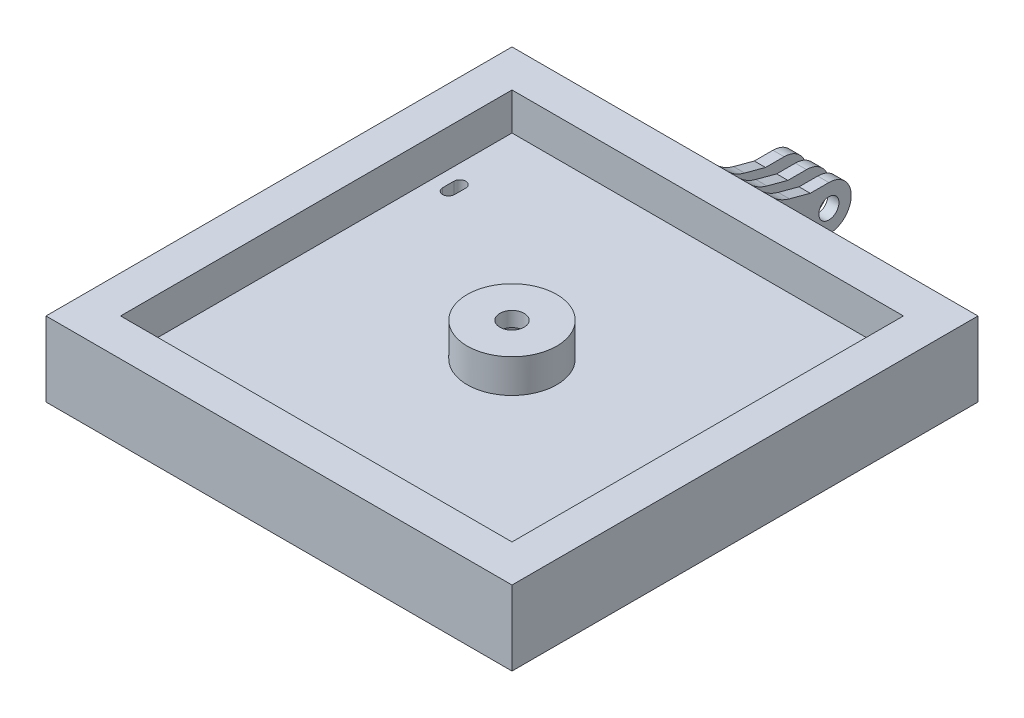
from build123d import *
from OCP.BRepFilletAPI import BRepFilletAPI_MakeChamfer

# Parameters (mm, degrees)
SKETCH1_W           = 125
SKETCH1_H           = 125
SKETCH1_W_2         = 105
SKETCH1_H_2         = 105
BOSS_EXTRUDE1_DEPTH = 10
SKETCH2_W           = 125
SKETCH2_H           = 125
BOSS_EXTRUDE2_DEPTH = 10
CUT_EXTRUDE1_DEPTH  = 10
CUT_EXTRUDE2_DEPTH  = 5
BOSS_EXTRUDE4_DEPTH = 1.5
LPATTERN3_COUNT     = 2
LPATTERN3_PITCH     = 6
LPATTERN3_COL_COUNT = 2
LPATTERN3_COL_PITCH = 6
CHAMFER1_SIZE       = 10
CHAMFER1_SIZE2      = 2.679491924
FILLET1_R           = 10
SKETCH6_R           = 2.7
CUT_EXTRUDE3_DEPTH  = 110.417777349
CUT_EXTRUDE4_DEPTH  = 10
SKETCH8_R           = 12
BOSS_EXTRUDE5_DEPTH = 5
SKETCH9_R           = 12
SKETCH9_R_2         = 3.25
BOSS_EXTRUDE6_DEPTH = 4


with BuildPart() as part:
    # Sketch1 → Boss-Extrude1 (new body)
    with BuildSketch(Plane(origin=(0, 0, 0), x_dir=(1, 0, 0), z_dir=(0, 1, 0))):
        Rectangle(SKETCH1_W, SKETCH1_H)
        Rectangle(SKETCH1_W_2, SKETCH1_H_2, mode=Mode.SUBTRACT)
    extrude(amount=BOSS_EXTRUDE1_DEPTH)

    # Sketch2 → Boss-Extrude2 (add)
    with BuildSketch(Plane.XZ):
        Rectangle(SKETCH2_W, SKETCH2_H)
    extrude(amount=BOSS_EXTRUDE2_DEPTH)

    # Sketch3 → Cut-Extrude1 (cut)
    with BuildSketch(Plane(origin=(0, 0, 0), x_dir=(1, 0, 0), z_dir=(0, 1, 0))):
        with BuildLine():
            Line((-45.9, 33.5), (-45.9, 30.5))
            ThreePointArc((-45.9, 30.5), (-47.5, 28.9), (-49.1, 30.5))
            Line((-49.1, 30.5), (-49.1, 33.5))
            ThreePointArc((-49.1, 33.5), (-47.5, 35.1), (-45.9, 33.5))
        make_face()
        with BuildLine():
            Line((-45.9, -46.5), (-45.9, -49.5))
            ThreePointArc((-45.9, -49.5), (-47.5, -51.1), (-49.1, -49.5))
            Line((-49.1, -49.5), (-49.1, -46.5))
            ThreePointArc((-49.1, -46.5), (-47.5, -44.9), (-45.9, -46.5))
        make_face()
    cut_extrude1 = extrude(amount=-CUT_EXTRUDE1_DEPTH, mode=Mode.SUBTRACT)

    # Sketch4 → Cut-Extrude2 (cut)
    with BuildSketch(Plane.XZ.offset(10)):
        with BuildLine():
            Line((-43.5, 49.5), (-43.5, 46.5))
            ThreePointArc((-43.5, 46.5), (-47.5, 42.5), (-51.5, 46.5))
            Line((-51.5, 46.5), (-51.5, 49.5))
            ThreePointArc((-51.5, 49.5), (-47.5, 53.5), (-43.5, 49.5))
        make_face()
        with BuildLine():
            Line((-43.5, -30.5), (-43.5, -33.5))
            ThreePointArc((-43.5, -33.5), (-47.5, -37.5), (-51.5, -33.5))
            Line((-51.5, -33.5), (-51.5, -30.5))
            ThreePointArc((-51.5, -30.5), (-47.5, -26.5), (-43.5, -30.5))
        make_face()
    cut_extrude2 = extrude(amount=-CUT_EXTRUDE2_DEPTH, mode=Mode.SUBTRACT)

    # Mirror1: Cut-Extrude1, Cut-Extrude2 across plane
    add(cut_extrude1.mirror(Plane(origin=(0, 0, 0), x_dir=(0, 0, 1), z_dir=(1, 0, 0))), mode=Mode.SUBTRACT)
    add(cut_extrude2.mirror(Plane(origin=(0, 0, 0), x_dir=(0, 0, 1), z_dir=(1, 0, 0))), mode=Mode.SUBTRACT)

    # Sketch5 → Boss-Extrude4 (add, symmetric)
    with BuildSketch(Plane(origin=(0, 0, 0), x_dir=(0, 0, -1), z_dir=(1, 0, 0))):
        with BuildLine():
            Line((62.5, 6), (77.5, 6))
            ThreePointArc((77.5, 6), (83.5, 0), (77.5, -6))
            Line((77.5, -6), (62.5, -6))
            Line((62.5, -6), (62.5, 6))
        make_face()
    boss_extrude4 = extrude(amount=BOSS_EXTRUDE4_DEPTH, both=True)

    # LPattern3: Boss-Extrude4 ×2
    with Locations(*[(i * LPATTERN3_PITCH, 0, 0) for i in range(1, LPATTERN3_COUNT)]):
        add(boss_extrude4)

    # LPattern3 col: Boss-Extrude4 ×2
    with Locations(*[(-i * LPATTERN3_COL_PITCH, 0, 0) for i in range(1, LPATTERN3_COL_COUNT)]):
        add(boss_extrude4)

    # Chamfer1: one chamfer whose edges measure the first distance from different faces: ONE call of the kernel's chamfer builder (chamfer() names one face for all edges)
    chamfer1_edges_1 = [part.edges().sort_by_distance(p)[0] for p in [
        (0, 6, -62.5),
    ]]
    chamfer1_side_1 = [part.faces().sort_by_distance(p)[0] for p in [
        (0, 6, -70),
    ]]
    chamfer1_edges_2 = [part.edges().sort_by_distance(p)[0] for p in [
        (0, -6, -62.5),
    ]]
    chamfer1_side_2 = [part.faces().sort_by_distance(p)[0] for p in [
        (0, -6, -70),
    ]]
    chamfer1_edges_3 = [part.edges().sort_by_distance(p)[0] for p in [
        (-6, 6, -62.5),
    ]]
    chamfer1_side_3 = [part.faces().sort_by_distance(p)[0] for p in [
        (-6, 6, -70),
    ]]
    chamfer1_edges_4 = [part.edges().sort_by_distance(p)[0] for p in [
        (-6, -6, -62.5),
    ]]
    chamfer1_side_4 = [part.faces().sort_by_distance(p)[0] for p in [
        (-6, -6, -70),
    ]]
    chamfer1_edges_5 = [part.edges().sort_by_distance(p)[0] for p in [
        (6, 6, -62.5),
    ]]
    chamfer1_side_5 = [part.faces().sort_by_distance(p)[0] for p in [
        (6, 6, -70),
    ]]
    chamfer1_edges_6 = [part.edges().sort_by_distance(p)[0] for p in [
        (6, -6, -62.5),
    ]]
    chamfer1_side_6 = [part.faces().sort_by_distance(p)[0] for p in [
        (6, -6, -70),
    ]]
    chamfer1 = BRepFilletAPI_MakeChamfer(part.part.solid().wrapped)
    for e in chamfer1_edges_1:
        chamfer1.Add(CHAMFER1_SIZE, CHAMFER1_SIZE2, e.wrapped, chamfer1_side_1[0].wrapped)  # the first distance lies on this face
    for e in chamfer1_edges_2:
        chamfer1.Add(CHAMFER1_SIZE, CHAMFER1_SIZE2, e.wrapped, chamfer1_side_2[0].wrapped)  # the first distance lies on this face
    for e in chamfer1_edges_3:
        chamfer1.Add(CHAMFER1_SIZE, CHAMFER1_SIZE2, e.wrapped, chamfer1_side_3[0].wrapped)  # the first distance lies on this face
    for e in chamfer1_edges_4:
        chamfer1.Add(CHAMFER1_SIZE, CHAMFER1_SIZE2, e.wrapped, chamfer1_side_4[0].wrapped)  # the first distance lies on this face
    for e in chamfer1_edges_5:
        chamfer1.Add(CHAMFER1_SIZE, CHAMFER1_SIZE2, e.wrapped, chamfer1_side_5[0].wrapped)  # the first distance lies on this face
    for e in chamfer1_edges_6:
        chamfer1.Add(CHAMFER1_SIZE, CHAMFER1_SIZE2, e.wrapped, chamfer1_side_6[0].wrapped)  # the first distance lies on this face
    add(Compound.cast(chamfer1.Shape()), mode=Mode.REPLACE)

    # Fillet1
    # the kernel refuses this fillet: 10 mm, written as the material it adds along each edge
    with BuildSketch(Plane(origin=(-12.86321037, 8.679491924, -62.5), x_dir=(0, 1.0, -1.888670768796517e-12), z_dir=(1, 0, 0))) as fillet1_piece_1_section:
        with BuildLine():
            CenterArc((8.48285216, -6.978597797), FILLET1_R, 135.744454957, 29.255545043)
            Line((-1.176406103, -4.390407346), (-1.369591268, -4.338643537))
            Line((-1.369591268, -4.338643537), (-0.193185165, 0.051763809))
            Line((-0.193185165, 0.051763809), (0, 0.2))
            ThreePointArc((0, 0.2), (0.660254038, 0.2), (1.177261194, 0.139571956))
            Line((1.177261194, 0.139571956), (1.320508076, 0))
        make_face()
    fillet1_piece_1 = extrude(amount=14.36321037, mode=Mode.PRIVATE)
    fillet1_piece_1 = split(fillet1_piece_1, bisect_by=Plane(origin=(-7.5, 8.578111025, -63.798963953), z_dir=(1, 0, 0)), keep=Keep.TOP, mode=Mode.PRIVATE)
    fillet1_piece_1 = split(fillet1_piece_1, bisect_by=Plane(origin=(-4.5, 8.578111025, -63.798963953), z_dir=(-1, 0, 0)), keep=Keep.TOP, mode=Mode.PRIVATE)
    add(fillet1_piece_1)
    with BuildSketch(Plane(origin=(-1.5, 8.679491924, -62.5), x_dir=(0, 1.0, -1.888670768796517e-12), z_dir=(1, 0, 0)), Plane(origin=(-7.5, 8.679491924, -62.5), x_dir=(0, 1.0, -1.888670768796517e-12), z_dir=(1, 0, 0)), Plane(origin=(4.5, 8.679491924, -62.5), x_dir=(0, 1.0, -1.888670768796517e-12), z_dir=(1, 0, 0))) as fillet1_piece_2:
        with BuildLine():
            CenterArc((8.48285216, -6.978597797), FILLET1_R, 135.744454957, 29.255545043)
            Line((-1.176406103, -4.390407346), (-1.369591268, -4.338643537))
            Line((-1.369591268, -4.338643537), (-0.193185165, 0.051763809))
            Line((-0.193185165, 0.051763809), (0, 0.2))
            ThreePointArc((0, 0.2), (0.660254038, 0.2), (1.177261194, 0.139571956))
            Line((1.177261194, 0.139571956), (1.320508076, 0))
        make_face()
    extrude(amount=3)
    with BuildSketch(Plane(origin=(-1.5, 8.679491924, -62.5), x_dir=(0, 1.0, -1.888670768796517e-12), z_dir=(1, 0, 0))) as fillet1_piece_3_section:
        with BuildLine():
            CenterArc((8.48285216, -6.978597797), FILLET1_R, 135.744454957, 29.255545043)
            Line((-1.176406103, -4.390407346), (-1.369591268, -4.338643537))
            Line((-1.369591268, -4.338643537), (-0.193185165, 0.051763809))
            Line((-0.193185165, 0.051763809), (0, 0.2))
            ThreePointArc((0, 0.2), (0.660254038, 0.2), (1.177261194, 0.139571956))
            Line((1.177261194, 0.139571956), (1.320508076, 0))
        make_face()
    fillet1_piece_3 = extrude(amount=14.36321037, mode=Mode.PRIVATE)
    fillet1_piece_3 = split(fillet1_piece_3, bisect_by=Plane(origin=(4.5, 8.578111025, -63.798963953), z_dir=(1, 0, 0)), keep=Keep.TOP, mode=Mode.PRIVATE)
    fillet1_piece_3 = split(fillet1_piece_3, bisect_by=Plane(origin=(7.5, 8.578111025, -63.798963953), z_dir=(-1, 0, 0)), keep=Keep.TOP, mode=Mode.PRIVATE)
    add(fillet1_piece_3)
    with BuildSketch(Plane(origin=(-12.86321037, -8.679491924, -62.5), x_dir=(0, -1.0, -1.7756733723730064e-12), z_dir=(1, 0, 0))) as fillet1_piece_4_section:
        with BuildLine():
            CenterArc((8.48285216, 6.978597797), FILLET1_R, 195, 29.255545043)
            Line((-1.176406103, 4.390407346), (-1.369591268, 4.338643537))
            Line((-1.369591268, 4.338643537), (-0.193185165, -0.051763809))
            Line((-0.193185165, -0.051763809), (0, -0.2))
            ThreePointArc((0, -0.2), (0.660254038, -0.2), (1.177261194, -0.139571956))
            Line((1.177261194, -0.139571956), (1.320508076, 0))
        make_face()
    fillet1_piece_4 = extrude(amount=14.36321037, mode=Mode.PRIVATE)
    fillet1_piece_4 = split(fillet1_piece_4, bisect_by=Plane(origin=(-4.5, -8.578111025, -63.798963953), z_dir=(-1, 0, 0)), keep=Keep.TOP, mode=Mode.PRIVATE)
    fillet1_piece_4 = split(fillet1_piece_4, bisect_by=Plane(origin=(-7.5, -8.578111025, -63.798963953), z_dir=(1, 0, 0)), keep=Keep.TOP, mode=Mode.PRIVATE)
    add(fillet1_piece_4)
    with BuildSketch(Plane(origin=(-1.5, -8.679491924, -62.5), x_dir=(0, -1.0, -1.9155749108021166e-12), z_dir=(1, 0, 0)), Plane(origin=(-7.5, -8.679491924, -62.5), x_dir=(0, -1.0, -1.7756733723730064e-12), z_dir=(1, 0, 0)), Plane(origin=(4.5, -8.679491924, -62.5), x_dir=(0, -1.0, -1.7756733723730064e-12), z_dir=(1, 0, 0))) as fillet1_piece_5:
        with BuildLine():
            CenterArc((8.48285216, 6.978597797), FILLET1_R, 195, 29.255545043)
            Line((-1.176406103, 4.390407346), (-1.369591268, 4.338643537))
            Line((-1.369591268, 4.338643537), (-0.193185165, -0.051763809))
            Line((-0.193185165, -0.051763809), (0, -0.2))
            ThreePointArc((0, -0.2), (0.660254038, -0.2), (1.177261194, -0.139571956))
            Line((1.177261194, -0.139571956), (1.320508076, 0))
        make_face()
    extrude(amount=3)
    with BuildSketch(Plane(origin=(-1.5, -8.679491924, -62.5), x_dir=(0, -1.0, -1.9155749108021166e-12), z_dir=(1, 0, 0))) as fillet1_piece_6_section:
        with BuildLine():
            CenterArc((8.48285216, 6.978597797), FILLET1_R, 195, 29.255545043)
            Line((-1.176406103, 4.390407346), (-1.369591268, 4.338643537))
            Line((-1.369591268, 4.338643537), (-0.193185165, -0.051763809))
            Line((-0.193185165, -0.051763809), (0, -0.2))
            ThreePointArc((0, -0.2), (0.660254038, -0.2), (1.177261194, -0.139571956))
            Line((1.177261194, -0.139571956), (1.320508076, 0))
        make_face()
    fillet1_piece_6 = extrude(amount=14.36321037, mode=Mode.PRIVATE)
    fillet1_piece_6 = split(fillet1_piece_6, bisect_by=Plane(origin=(7.5, -8.578111025, -63.798963953), z_dir=(-1, 0, 0)), keep=Keep.TOP, mode=Mode.PRIVATE)
    fillet1_piece_6 = split(fillet1_piece_6, bisect_by=Plane(origin=(4.5, -8.578111025, -63.798963953), z_dir=(1, 0, 0)), keep=Keep.TOP, mode=Mode.PRIVATE)
    add(fillet1_piece_6)
    with BuildSketch(Plane(origin=(-7.5, -8.679491924, -62.5), x_dir=(0, -1.0, -1.7756733723730064e-12), z_dir=(1, 0, 0))) as fillet1_piece_7_section:
        with BuildLine():
            CenterArc((8.48285216, 6.978597797), FILLET1_R, 195, 29.255545043)
            Line((-1.176406103, 4.390407346), (-1.369591268, 4.338643537))
            Line((-1.369591268, 4.338643537), (-0.193185165, -0.051763809))
            Line((-0.193185165, -0.051763809), (0, -0.2))
            ThreePointArc((0, -0.2), (0.660254038, -0.2), (1.177261194, -0.139571956))
            Line((1.177261194, -0.139571956), (1.320508076, 0))
        make_face()
    fillet1_piece_7 = extrude(amount=14.36321037, mode=Mode.PRIVATE)
    fillet1_piece_7 = split(fillet1_piece_7, bisect_by=Plane(origin=(1.5, -8.578111025, -63.798963953), z_dir=(-1, 0, 0)), keep=Keep.TOP, mode=Mode.PRIVATE)
    fillet1_piece_7 = split(fillet1_piece_7, bisect_by=Plane(origin=(-1.5, -8.578111025, -63.798963953), z_dir=(1, 0, 0)), keep=Keep.TOP, mode=Mode.PRIVATE)
    add(fillet1_piece_7)
    with BuildSketch(Plane(origin=(-7.5, -8.679491924, -62.5), x_dir=(0, -1.0, -1.7756733723730064e-12), z_dir=(1, 0, 0))) as fillet1_piece_8_section:
        with BuildLine():
            CenterArc((8.48285216, 6.978597797), FILLET1_R, 195, 29.255545043)
            Line((-1.176406103, 4.390407346), (-1.369591268, 4.338643537))
            Line((-1.369591268, 4.338643537), (-0.193185165, -0.051763809))
            Line((-0.193185165, -0.051763809), (0, -0.2))
            ThreePointArc((0, -0.2), (0.660254038, -0.2), (1.177261194, -0.139571956))
            Line((1.177261194, -0.139571956), (1.320508076, 0))
        make_face()
    fillet1_piece_8 = extrude(amount=14.36321037, mode=Mode.PRIVATE)
    fillet1_piece_8 = split(fillet1_piece_8, bisect_by=Plane(origin=(4.5, -8.578111025, -63.798963953), z_dir=(1, 0, 0)), keep=Keep.TOP, mode=Mode.PRIVATE)
    add(fillet1_piece_8)
    with BuildSketch(Plane(origin=(-6.86321037, -8.679491924, -62.5), x_dir=(0, -1.0, -1.9155749108021166e-12), z_dir=(1, 0, 0))) as fillet1_piece_9_section:
        with BuildLine():
            CenterArc((8.48285216, 6.978597797), FILLET1_R, 195, 29.255545043)
            Line((-1.176406103, 4.390407346), (-1.369591268, 4.338643537))
            Line((-1.369591268, 4.338643537), (-0.193185165, -0.051763809))
            Line((-0.193185165, -0.051763809), (0, -0.2))
            ThreePointArc((0, -0.2), (0.660254038, -0.2), (1.177261194, -0.139571956))
            Line((1.177261194, -0.139571956), (1.320508076, 0))
        make_face()
    fillet1_piece_9 = extrude(amount=14.36321037, mode=Mode.PRIVATE)
    fillet1_piece_9 = split(fillet1_piece_9, bisect_by=Plane(origin=(-4.5, -8.578111025, -63.798963953), z_dir=(-1, 0, 0)), keep=Keep.TOP, mode=Mode.PRIVATE)
    add(fillet1_piece_9)
    with BuildSketch(Plane(origin=(-6.86321037, -8.679491924, -62.5), x_dir=(0, -1.0, -1.9155749108021166e-12), z_dir=(1, 0, 0))) as fillet1_piece_10_section:
        with BuildLine():
            CenterArc((8.48285216, 6.978597797), FILLET1_R, 195, 29.255545043)
            Line((-1.176406103, 4.390407346), (-1.369591268, 4.338643537))
            Line((-1.369591268, 4.338643537), (-0.193185165, -0.051763809))
            Line((-0.193185165, -0.051763809), (0, -0.2))
            ThreePointArc((0, -0.2), (0.660254038, -0.2), (1.177261194, -0.139571956))
            Line((1.177261194, -0.139571956), (1.320508076, 0))
        make_face()
    fillet1_piece_10 = extrude(amount=14.36321037, mode=Mode.PRIVATE)
    fillet1_piece_10 = split(fillet1_piece_10, bisect_by=Plane(origin=(1.5, -8.578111025, -63.798963953), z_dir=(-1, 0, 0)), keep=Keep.TOP, mode=Mode.PRIVATE)
    fillet1_piece_10 = split(fillet1_piece_10, bisect_by=Plane(origin=(-1.5, -8.578111025, -63.798963953), z_dir=(1, 0, 0)), keep=Keep.TOP, mode=Mode.PRIVATE)
    add(fillet1_piece_10)
    with BuildSketch(Plane(origin=(-7.5, 8.679491924, -62.5), x_dir=(0, 1.0, -1.888670768796517e-12), z_dir=(1, 0, 0))) as fillet1_piece_11_section:
        with BuildLine():
            CenterArc((8.48285216, -6.978597797), FILLET1_R, 135.744454957, 29.255545043)
            Line((-1.176406103, -4.390407346), (-1.369591268, -4.338643537))
            Line((-1.369591268, -4.338643537), (-0.193185165, 0.051763809))
            Line((-0.193185165, 0.051763809), (0, 0.2))
            ThreePointArc((0, 0.2), (0.660254038, 0.2), (1.177261194, 0.139571956))
            Line((1.177261194, 0.139571956), (1.320508076, 0))
        make_face()
    fillet1_piece_11 = extrude(amount=14.36321037, mode=Mode.PRIVATE)
    fillet1_piece_11 = split(fillet1_piece_11, bisect_by=Plane(origin=(-1.5, 8.578111025, -63.798963953), z_dir=(1, 0, 0)), keep=Keep.TOP, mode=Mode.PRIVATE)
    fillet1_piece_11 = split(fillet1_piece_11, bisect_by=Plane(origin=(1.5, 8.578111025, -63.798963953), z_dir=(-1, 0, 0)), keep=Keep.TOP, mode=Mode.PRIVATE)
    add(fillet1_piece_11)
    with BuildSketch(Plane(origin=(-7.5, 8.679491924, -62.5), x_dir=(0, 1.0, -1.888670768796517e-12), z_dir=(1, 0, 0))) as fillet1_piece_12_section:
        with BuildLine():
            CenterArc((8.48285216, -6.978597797), FILLET1_R, 135.744454957, 29.255545043)
            Line((-1.176406103, -4.390407346), (-1.369591268, -4.338643537))
            Line((-1.369591268, -4.338643537), (-0.193185165, 0.051763809))
            Line((-0.193185165, 0.051763809), (0, 0.2))
            ThreePointArc((0, 0.2), (0.660254038, 0.2), (1.177261194, 0.139571956))
            Line((1.177261194, 0.139571956), (1.320508076, 0))
        make_face()
    fillet1_piece_12 = extrude(amount=14.36321037, mode=Mode.PRIVATE)
    fillet1_piece_12 = split(fillet1_piece_12, bisect_by=Plane(origin=(4.5, 8.578111025, -63.798963953), z_dir=(1, 0, 0)), keep=Keep.TOP, mode=Mode.PRIVATE)
    add(fillet1_piece_12)
    with BuildSketch(Plane(origin=(-6.86321037, 8.679491924, -62.5), x_dir=(0, 1.0, -1.8832899403953976e-12), z_dir=(1, 0, 0))) as fillet1_piece_13_section:
        with BuildLine():
            CenterArc((8.48285216, -6.978597797), FILLET1_R, 135.744454957, 29.255545043)
            Line((-1.176406103, -4.390407346), (-1.369591268, -4.338643537))
            Line((-1.369591268, -4.338643537), (-0.193185165, 0.051763809))
            Line((-0.193185165, 0.051763809), (0, 0.2))
            ThreePointArc((0, 0.2), (0.660254038, 0.2), (1.177261194, 0.139571956))
            Line((1.177261194, 0.139571956), (1.320508076, 0))
        make_face()
    fillet1_piece_13 = extrude(amount=14.36321037, mode=Mode.PRIVATE)
    fillet1_piece_13 = split(fillet1_piece_13, bisect_by=Plane(origin=(-4.5, 8.578111025, -63.798963953), z_dir=(-1, 0, 0)), keep=Keep.TOP, mode=Mode.PRIVATE)
    add(fillet1_piece_13)
    with BuildSketch(Plane(origin=(-6.86321037, 8.679491924, -62.5), x_dir=(0, 1.0, -1.8832899403953976e-12), z_dir=(1, 0, 0))) as fillet1_piece_14_section:
        with BuildLine():
            CenterArc((8.48285216, -6.978597797), FILLET1_R, 135.744454957, 29.255545043)
            Line((-1.176406103, -4.390407346), (-1.369591268, -4.338643537))
            Line((-1.369591268, -4.338643537), (-0.193185165, 0.051763809))
            Line((-0.193185165, 0.051763809), (0, 0.2))
            ThreePointArc((0, 0.2), (0.660254038, 0.2), (1.177261194, 0.139571956))
            Line((1.177261194, 0.139571956), (1.320508076, 0))
        make_face()
    fillet1_piece_14 = extrude(amount=14.36321037, mode=Mode.PRIVATE)
    fillet1_piece_14 = split(fillet1_piece_14, bisect_by=Plane(origin=(-1.5, 8.578111025, -63.798963953), z_dir=(1, 0, 0)), keep=Keep.TOP, mode=Mode.PRIVATE)
    fillet1_piece_14 = split(fillet1_piece_14, bisect_by=Plane(origin=(1.5, 8.578111025, -63.798963953), z_dir=(-1, 0, 0)), keep=Keep.TOP, mode=Mode.PRIVATE)
    add(fillet1_piece_14)

    # Sketch6 → Cut-Extrude3 (cut, through all)
    with BuildSketch(Plane.ZY.offset(7.5)):
        with Locations((-77.5, 0)):
            Circle(SKETCH6_R)
    extrude(amount=-CUT_EXTRUDE3_DEPTH, mode=Mode.SUBTRACT)

    # Sketch7 → Cut-Extrude4 (cut)
    with BuildSketch(Plane(origin=(0, 0, 0), x_dir=(1, 0, 0), z_dir=(0, 1, 0))):
        Polygon((8.5, 0), (4.25, 7.361215932), (-4.25, 7.361215932), (-8.5, 0), (-4.25, -7.361215932), (4.25, -7.361215932), align=None)
    extrude(amount=-CUT_EXTRUDE4_DEPTH, mode=Mode.SUBTRACT)

    # Sketch8 → Boss-Extrude5 (add)
    with BuildSketch(Plane(origin=(0, 0, 0), x_dir=(1, 0, 0), z_dir=(0, 1, 0))):
        with Locations(Location((0, 0, 0), (0, 0, 90))):
            Circle(SKETCH8_R)
        Polygon((8.5, 0), (4.25, 7.361215932), (-4.25, 7.361215932), (-8.5, 0), (-4.25, -7.361215932), (4.25, -7.361215932), align=None, mode=Mode.SUBTRACT)
    extrude(amount=BOSS_EXTRUDE5_DEPTH)

    # Sketch9 → Boss-Extrude6 (add)
    with BuildSketch(Plane(origin=(0, 5, 0), x_dir=(1, 0, 0), z_dir=(0, 1, 0))):
        with Locations(Location((0, 0, 0), (0, 0, 90))):
            Circle(SKETCH9_R)
        with Locations(Location((0, 0, 0), (0, 0, 270))):
            Circle(SKETCH9_R_2, mode=Mode.SUBTRACT)
    extrude(amount=BOSS_EXTRUDE6_DEPTH)


solid = part.part
